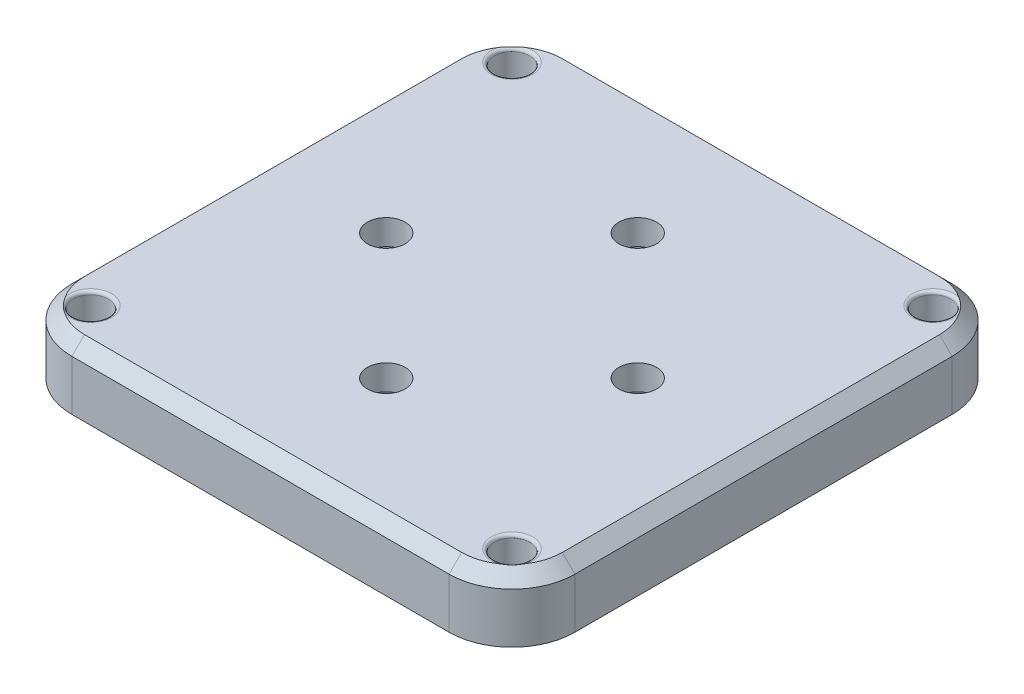
from build123d import *

# Parameters (mm, degrees)
SKETCH1_R                = 1.841177256
BOSS_EXTRUDE1_DEPTH      = 10
SKETCH2_R                = 2.8
CUT_EXTRUDE1_DEPTH       = 5
FILLET1_R                = 0.5
CIRPATTERN1_COUNT        = 4
FILLET1_OF_CIRPATTERN1_R = 0.5
SKETCH4_R                = 3
CUT_EXTRUDE2_DEPTH       = 10
SKETCH5_R                = 5.25
CUT_EXTRUDE3_DEPTH       = 6
CHAMFER1_SIZE            = 2


with BuildPart() as part:
    # Sketch1 → Boss-Extrude1 (new body)
    with BuildSketch(Plane(origin=(0, 0, 0), x_dir=(1, 0, 0), z_dir=(0, 1, 0))):
        with BuildLine():
            Line((-30, 40), (30, 40))
            ThreePointArc((30, 40), (37.071067812, 37.071067812), (40, 30))
            Line((40, 30), (40, -30))
            ThreePointArc((40, -30), (37.071067812, -37.071067812), (30, -40))
            Line((30, -40), (-30, -40))
            ThreePointArc((-30, -40), (-37.071067812, -37.071067812), (-40, -30))
            Line((-40, -30), (-40, 30))
            ThreePointArc((-40, 30), (-37.071067812, 37.071067812), (-30, 40))
        make_face()
        with Locations(Location((-33.5, 33.5, 0), (0, 0, 270))):
            Circle(SKETCH1_R, mode=Mode.SUBTRACT)
        with Locations(Location((33.5, 33.5, 0), (0, 0, 270))):
            Circle(SKETCH1_R, mode=Mode.SUBTRACT)
        with Locations(Location((33.5, -33.5, 0), (0, 0, 270))):
            Circle(SKETCH1_R, mode=Mode.SUBTRACT)
        with Locations(Location((-33.5, -33.5, 0), (0, 0, 270))):
            Circle(SKETCH1_R, mode=Mode.SUBTRACT)
    extrude(amount=BOSS_EXTRUDE1_DEPTH)

    # Sketch2 → Cut-Extrude1 (cut)
    with BuildSketch(Plane(origin=(0, 10, 0), x_dir=(1, 0, 0), z_dir=(0, 1, 0))):
        with Locations(Location((-33.5, 33.5, 0), (0, 0, 270))):
            Circle(SKETCH2_R)
    cut_extrude1 = extrude(amount=-CUT_EXTRUDE1_DEPTH, mode=Mode.SUBTRACT)

    # Fillet1
    fillet1_edges = [part.edges().sort_by_distance(p)[0] for p in [
        (-33.5, 10, -36.3),
    ]]
    fillet(fillet1_edges, radius=FILLET1_R)

    # CirPattern1: Cut-Extrude1 ×4 about axis
    cirpattern1_axis = Axis((0, 0, 0), (0, 1, 0))
    for i in range(1, CIRPATTERN1_COUNT):
        add(cut_extrude1.rotate(cirpattern1_axis, i * 360 / CIRPATTERN1_COUNT), mode=Mode.SUBTRACT)

    # Fillet1 of CirPattern1
    fillet1_of_cirpattern1_edges = [part.edges().sort_by_distance(p)[0] for p in [
        (-36.3, 10, 33.5),
        (33.5, 10, 36.3),
        (36.3, 10, -33.5),
    ]]
    fillet(fillet1_of_cirpattern1_edges, radius=FILLET1_OF_CIRPATTERN1_R)

    # Sketch4 → Cut-Extrude2 (cut)
    with BuildSketch(Plane.XZ):
        with Locations(Location((20, 0, 0), (0, 0, 270))):
            Circle(SKETCH4_R)
        with Locations(Location((0, -20, 0), (0, 0, 270))):
            Circle(SKETCH4_R)
        with Locations(Location((-20, 0, 0), (0, 0, 270))):
            Circle(SKETCH4_R)
        with Locations(Location((0, 20, 0), (0, 0, 270))):
            Circle(SKETCH4_R)
    extrude(amount=-CUT_EXTRUDE2_DEPTH, mode=Mode.SUBTRACT)

    # Sketch5 → Cut-Extrude3 (cut)
    with BuildSketch(Plane.XZ):
        with Locations(Location((20, 0, 0), (0, 0, 270))):
            Circle(SKETCH5_R)
        with Locations(Location((0, -20, 0), (0, 0, 270))):
            Circle(SKETCH5_R)
        with Locations(Location((-20, 0, 0), (0, 0, 270))):
            Circle(SKETCH5_R)
        with Locations(Location((0, 20, 0), (0, 0, 270))):
            Circle(SKETCH5_R)
    extrude(amount=-CUT_EXTRUDE3_DEPTH, mode=Mode.SUBTRACT)

    # Chamfer1
    # the kernel refuses this chamfer: 2 mm, written as the material it takes off along each edge
    with BuildSketch(Plane(origin=(30, 10, -30), x_dir=(0, 0, -1), z_dir=(-1, 0, 0))) as chamfer1_piece_1:
        Polygon((10 - CHAMFER1_SIZE, 0), (10, CHAMFER1_SIZE), (10, 0), align=None)
    revolve(axis=Axis((30, 10, -30), (0, -1, 0)), revolution_arc=90, mode=Mode.SUBTRACT)
    with BuildSketch(Plane(origin=(-30, 10, -40), x_dir=(0, 0.02749587661058651, 0.9996219169112968), z_dir=(1, 0, 0)), Plane(origin=(-40, 10, 30), x_dir=(0.9996219169112968, 0.02749587661058651, 0), z_dir=(0, 0, -1)), Plane(origin=(30, 10, 40), x_dir=(0, 0.02749587661058651, -0.9996219169112968), z_dir=(-1, 0, 0)), Plane(origin=(40, 10, -30), x_dir=(-0.9996219169112968, 0.02749587661058651, 0), z_dir=(0, 0, 1))) as chamfer1_piece_2:
        Polygon((CHAMFER1_SIZE * 0.999621916911, CHAMFER1_SIZE * 0.0274958766106), (-CHAMFER1_SIZE * 0.0274958766106, CHAMFER1_SIZE * 0.999621916911), (0, 0), align=None)
    extrude(amount=60, mode=Mode.SUBTRACT)
    with BuildSketch(Plane(origin=(-30, 10, -30), x_dir=(-1, 0, 0), z_dir=(0, 0, 1))) as chamfer1_piece_3:
        Polygon((10 - CHAMFER1_SIZE, 0), (10, CHAMFER1_SIZE), (10, 0), align=None)
    revolve(axis=Axis((-30, 10, -30), (0, -1, 0)), revolution_arc=90, mode=Mode.SUBTRACT)
    with BuildSketch(Plane(origin=(-30, 10, 30), x_dir=(0, 0, 1), z_dir=(1, 0, 0))) as chamfer1_piece_4:
        Polygon((10 - CHAMFER1_SIZE, 0), (10, CHAMFER1_SIZE), (10, 0), align=None)
    revolve(axis=Axis((-30, 10, 30), (0, -1, 0)), revolution_arc=90, mode=Mode.SUBTRACT)
    with BuildSketch(Plane(origin=(30, 10, 30), x_dir=(1, 0, 0), z_dir=(0, 0, -1))) as chamfer1_piece_5:
        Polygon((10 - CHAMFER1_SIZE, 0), (10, CHAMFER1_SIZE), (10, 0), align=None)
    revolve(axis=Axis((30, 10, 30), (0, -1, 0)), revolution_arc=90, mode=Mode.SUBTRACT)


solid = part.part
